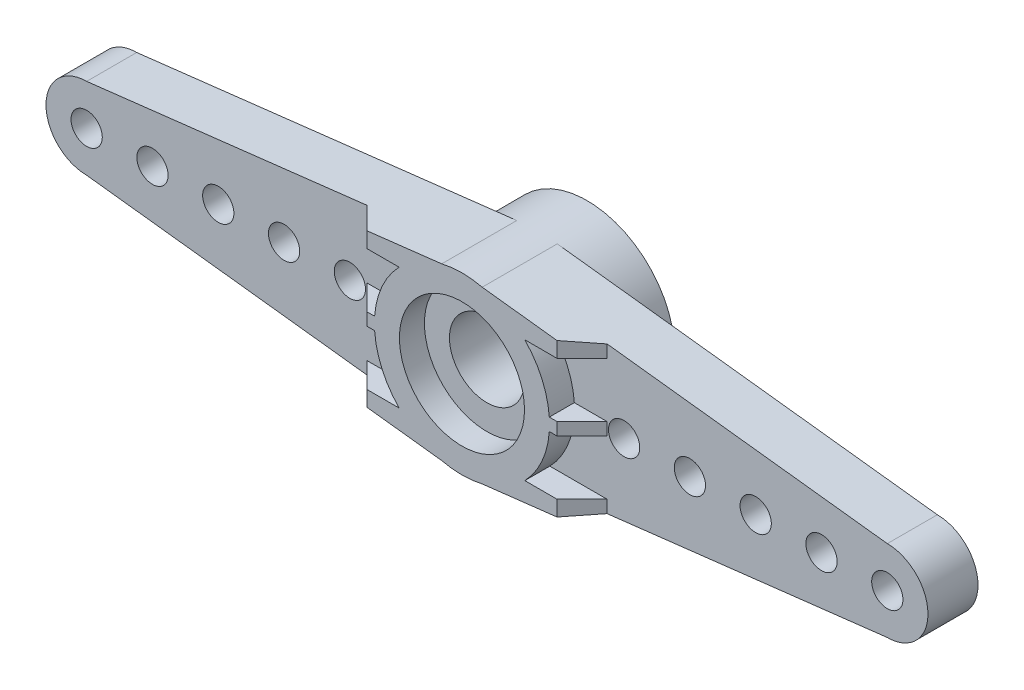
from build123d import *

# Parameters (mm, degrees)
SKETCH_1_R      = 3.5
SKETCH_1_R_2    = 2.5
EXTRUDE_1_DEPTH = 5
EXTRUDE_START   = -3
SKETCH_2_R      = 0.625
SKETCH_2_R_2    = 1.625
SKETCH_2_R_3    = 2.5
SKETCH_2_R_4    = 1.5
EXTRUDE_2_DEPTH = 2
EXTRUDE_3_DEPTH = 1
CHAMFER_1_SIZE  = 1


with BuildPart() as part:
    # Эскиз1 → Бобышка-Вытянуть1 (new body)
    with BuildSketch(Plane.XY):
        Circle(SKETCH_1_R)
        Circle(SKETCH_1_R_2, mode=Mode.SUBTRACT)
    extrude(amount=EXTRUDE_1_DEPTH)

    # Эскиз2 → Бобышка-Вытянуть2 (add)
    # profile 1 of 5: a face of its own
    with BuildSketch(Plane.XY.offset(5).offset(EXTRUDE_START)):
        with BuildLine():
            Line((-0.809199831, 3.405171895), (-16, 1.625))
            ThreePointArc((-16, 1.625), (-14.850951481, 1.149048519), (-14.375, 0))
            ThreePointArc((-14.375, 0), (-14.850951481, -1.149048519), (-16, -1.625))
            Line((-16, -1.625), (-0.809199831, -3.405171895))
            ThreePointArc((-0.809199831, -3.405171895), (-3.5, 0), (-0.809199831, 3.405171895))
        make_face()
        with Locations((-13.37, 0)):
            Circle(SKETCH_2_R, mode=Mode.SUBTRACT)
        with Locations((-10.74, 0)):
            Circle(SKETCH_2_R, mode=Mode.SUBTRACT)
        with Locations((-8.11, 0)):
            Circle(SKETCH_2_R, mode=Mode.SUBTRACT)
        with Locations((-5.48, 0)):
            Circle(SKETCH_2_R, mode=Mode.SUBTRACT)
    # profile 2 of 5: a face of its own
    with BuildSketch(Plane.XY.offset(5).offset(EXTRUDE_START)):
        with Locations((-16, 0)):
            Circle(SKETCH_2_R_2)
        with Locations((-16, 0)):
            Circle(SKETCH_2_R, mode=Mode.SUBTRACT)
    # profile 3 of 5: a face of its own
    with BuildSketch(Plane.XY.offset(5).offset(EXTRUDE_START)):
        with BuildLine():
            Line((16, 1.625), (0.809199831, 3.405171895))
            ThreePointArc((0.809199831, 3.405171895), (2.746106281, 2.170000068), (3.5, 0))
            ThreePointArc((3.5, 0), (2.746106281, -2.170000068), (0.809199831, -3.405171895))
            Line((0.809199831, -3.405171895), (16, -1.625))
            ThreePointArc((16, -1.625), (14.375, 0), (16, 1.625))
        make_face()
        with Locations((5.48, 0)):
            Circle(SKETCH_2_R, mode=Mode.SUBTRACT)
        with Locations((8.11, 0)):
            Circle(SKETCH_2_R, mode=Mode.SUBTRACT)
        with Locations((10.74, 0)):
            Circle(SKETCH_2_R, mode=Mode.SUBTRACT)
        with Locations((13.37, 0)):
            Circle(SKETCH_2_R, mode=Mode.SUBTRACT)
    # profile 4 of 5: a face of its own
    with BuildSketch(Plane.XY.offset(5).offset(EXTRUDE_START)):
        with Locations((16, 0)):
            Circle(SKETCH_2_R_2)
        with Locations((16, 0)):
            Circle(SKETCH_2_R, mode=Mode.SUBTRACT)
    # profile 5 of 5: a face of its own
    with BuildSketch(Plane.XY.offset(5).offset(EXTRUDE_START)):
        Circle(SKETCH_2_R_3)
        Circle(SKETCH_2_R_4, mode=Mode.SUBTRACT)
    extrude(amount=EXTRUDE_2_DEPTH)

    # Эскиз3 → Бобышка-Вытянуть3 (add)
    with BuildSketch(Plane.XY.offset(4)):
        with BuildLine():
            ThreePointArc((-2.511691412, 2.4375), (-1.729501919, 3.04283143), (-0.809199831, 3.405171895))
            Line((-0.809199831, 3.405171895), (-4.8, 2.9375))
            Line((-4.8, 2.9375), (-4.8, 2.4375))
            Line((-4.8, 2.4375), (-2.511691412, 2.4375))
        make_face()
        with BuildLine():
            ThreePointArc((-3.491060011, -0.25), (-3.5, 0), (-3.491060011, 0.25))
            Line((-3.491060011, 0.25), (-4.8, 0.25))
            Line((-4.8, 0.25), (-4.8, -0.25))
            Line((-4.8, -0.25), (-3.491060011, -0.25))
        make_face()
        with BuildLine():
            ThreePointArc((-0.809199831, -3.405171895), (-1.729501919, -3.04283143), (-2.511691412, -2.4375))
            Line((-2.511691412, -2.4375), (-4.8, -2.4375))
            Line((-4.8, -2.4375), (-4.8, -2.9375))
            Line((-4.8, -2.9375), (-0.809199831, -3.405171895))
        make_face()
        with BuildLine():
            Line((4.8, -2.4375), (2.511691412, -2.4375))
            ThreePointArc((2.511691412, -2.4375), (1.729501919, -3.04283143), (0.809199831, -3.405171895))
            Line((0.809199831, -3.405171895), (4.8, -2.9375))
            Line((4.8, -2.9375), (4.8, -2.4375))
        make_face()
        with BuildLine():
            Line((4.8, 0.25), (3.491060011, 0.25))
            ThreePointArc((3.491060011, 0.25), (3.497764289, 0.125079898), (3.5, 0))
            ThreePointArc((3.5, 0), (3.497764289, -0.125079898), (3.491060011, -0.25))
            Line((3.491060011, -0.25), (4.8, -0.25))
            Line((4.8, -0.25), (4.8, 0.25))
        make_face()
        with BuildLine():
            Line((4.8, 2.9375), (0.809199831, 3.405171895))
            ThreePointArc((0.809199831, 3.405171895), (1.729501919, 3.04283143), (2.511691412, 2.4375))
            Line((2.511691412, 2.4375), (4.8, 2.4375))
            Line((4.8, 2.4375), (4.8, 2.9375))
        make_face()
    extrude(amount=EXTRUDE_3_DEPTH)

    # Фаска1
    chamfer_1_edges = [part.edges().sort_by_distance(p)[0] for p in [
        (4.8, 2.6875, 5),
        (4.8, 0, 5),
        (4.8, -2.6875, 5),
        (-4.8, -2.6875, 5),
        (-4.8, 0, 5),
        (-4.8, 2.6875, 5),
    ]]
    chamfer(chamfer_1_edges, length=CHAMFER_1_SIZE - 0.0001)  # a hair under: the kernel refuses the full size


solid = part.part
